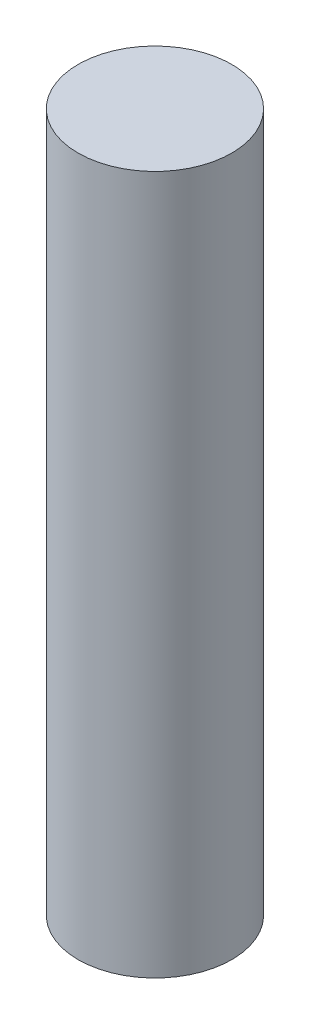
from build123d import *

# Parameters (mm, degrees)
SKETCH1_R           = 27.5
BOSS_EXTRUDE1_DEPTH = 250


with BuildPart() as part:
    # Sketch1 → Boss-Extrude1 (new body)
    with BuildSketch(Plane(origin=(0, 0, 0), x_dir=(1, 0, 0), z_dir=(0, 1, 0))):
        Circle(SKETCH1_R)
    extrude(amount=BOSS_EXTRUDE1_DEPTH)


solid = part.part
